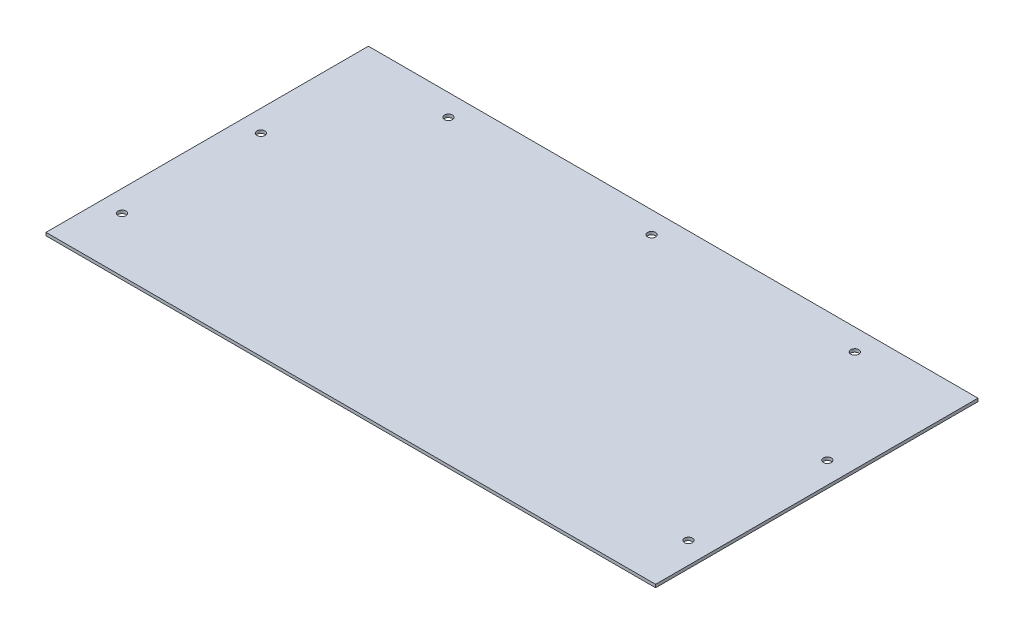
from build123d import *

# Parameters (mm, degrees)
SKETCH1_W           = 457.2
SKETCH1_H           = 2.286
BOSS_EXTRUDE1_DEPTH = 238.620000026
SKETCH2_W           = 457.2
SKETCH2_H           = 2.286
BOSS_EXTRUDE2_DEPTH = 3.175
SKETCH6_R           = 3
CUT_EXTRUDE6_DEPTH  = 2.286


with BuildPart() as part:
    # Sketch1 → Boss-Extrude1 (new body)
    with BuildSketch(Plane.XY):
        Rectangle(SKETCH1_W, SKETCH1_H)
    extrude(amount=BOSS_EXTRUDE1_DEPTH)

    # Sketch2 → Boss-Extrude2 (add)
    with BuildSketch(Plane(origin=(0, 0, 0), x_dir=(-1, 0, 0), z_dir=(0, 0, -1))):
        Rectangle(SKETCH2_W, SKETCH2_H)
    extrude(amount=BOSS_EXTRUDE2_DEPTH)

    # Sketch6 → Cut-Extrude6 (cut)
    with BuildSketch(Plane.XZ.offset(1.143)):
        with Locations((-212.419, 197.784793717)):
            Circle(SKETCH6_R)
        with Locations((212.419, 197.784793717)):
            Circle(SKETCH6_R)
        with Locations((212.419, 93.644793717)):
            Circle(SKETCH6_R)
        with Locations((152.4, 13.0175)):
            Circle(SKETCH6_R)
        with Locations((0, 13.0175)):
            Circle(SKETCH6_R)
        with Locations((-152.4, 13.0175)):
            Circle(SKETCH6_R)
        with Locations((-212.419, 93.644793717)):
            Circle(SKETCH6_R)
    extrude(amount=-CUT_EXTRUDE6_DEPTH, mode=Mode.SUBTRACT)


solid = part.part
